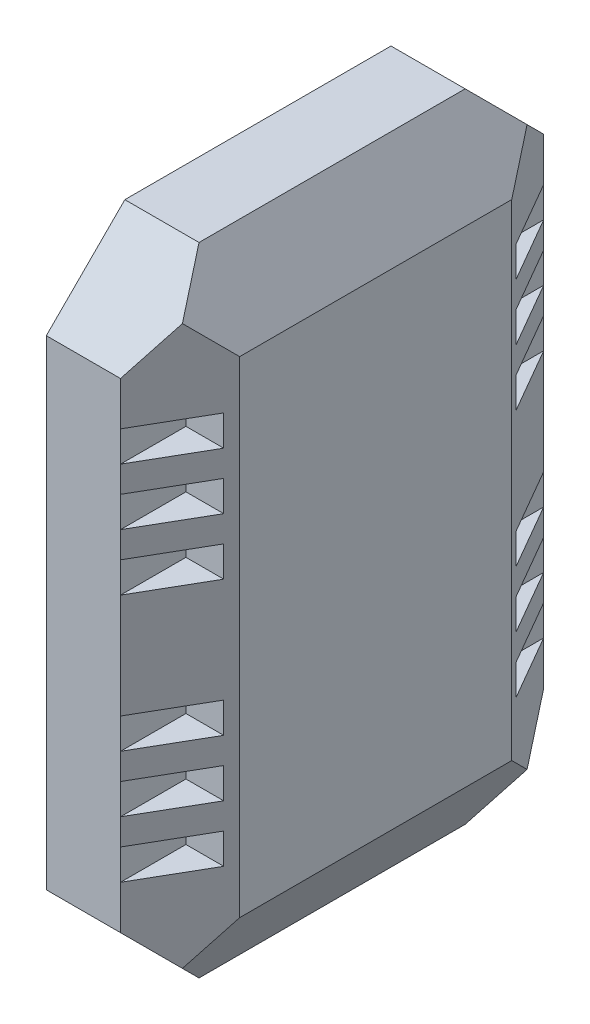
from build123d import *
from OCP.BRepFilletAPI import BRepFilletAPI_MakeChamfer

# Parameters (mm, degrees)
SKETCH1_W               = 37.084
SKETCH1_H               = 24.638
BOSS_EXTRUDE1_DEPTH     = 6.858
CHAMFER2_SIZE           = 4.572
CHAMFER3_SIZE           = 2.54
CHAMFER3_SIZE2          = 4.399409051
CHAMFER4_SIZE           = 2.54
CHAMFER4_SIZE2          = 4.399409051
CUT_EXTRUDE1_DEPTH      = 46.04759998
CUT_EXTRUDE1_DEPTH_BACK = 2.54
SKETCH3_R               = 1
SKETCH4_W               = 1.778
SKETCH4_H               = 3.81
CUT_EXTRUDE2_DEPTH      = 2.54
SKETCH5_R               = 1.5875
CUT_EXTRUDE3_DEPTH      = 3.81


with BuildPart() as part:
    # Sketch1 → Boss-Extrude1 (new body)
    with BuildSketch(Plane.YZ):
        with Locations((18.542, -12.319)):
            Rectangle(SKETCH1_W, SKETCH1_H)
    extrude(amount=BOSS_EXTRUDE1_DEPTH)

    # Chamfer2
    chamfer2_edges = [part.edges().sort_by_distance(p)[0] for p in [
        (3.429, 0, 0),
        (3.429, 0, -24.638),
        (3.429, 37.084, 0),
        (3.429, 37.084, -24.638),
    ]]
    chamfer(chamfer2_edges, length=CHAMFER2_SIZE)

    # Chamfer3: one chamfer whose edges measure the first distance from different faces: ONE call of the kernel's chamfer builder (chamfer() names one face for all edges)
    chamfer3_edges_1 = [part.edges().sort_by_distance(p)[0] for p in [
        (6.858, 18.542, 0),
    ]]
    chamfer3_side_1 = [part.faces().sort_by_distance(p)[0] for p in [
        (3.429, 18.542, 0),
    ]]
    chamfer3_edges_2 = [part.edges().sort_by_distance(p)[0] for p in [
        (6.858, 18.542, -24.638),
    ]]
    chamfer3_side_2 = [part.faces().sort_by_distance(p)[0] for p in [
        (3.429, 18.542, -24.638),
    ]]
    chamfer3 = BRepFilletAPI_MakeChamfer(part.part.solid().wrapped)
    for e in chamfer3_edges_1:
        chamfer3.Add(CHAMFER3_SIZE, CHAMFER3_SIZE2, e.wrapped, chamfer3_side_1[0].wrapped)  # the first distance lies on this face
    for e in chamfer3_edges_2:
        chamfer3.Add(CHAMFER3_SIZE, CHAMFER3_SIZE2, e.wrapped, chamfer3_side_2[0].wrapped)  # the first distance lies on this face
    add(Compound.cast(chamfer3.Shape()), mode=Mode.REPLACE)

    # Chamfer4: one chamfer whose edges measure the first distance from different faces: ONE call of the kernel's chamfer builder (chamfer() names one face for all edges)
    chamfer4_edges_1 = [part.edges().sort_by_distance(p)[0] for p in [
        (6.858, 0, -12.319),
    ]]
    chamfer4_side_1 = [part.faces().sort_by_distance(p)[0] for p in [
        (3.429, 0, -12.319),
    ]]
    chamfer4_edges_2 = [part.edges().sort_by_distance(p)[0] for p in [
        (6.858, 37.084, -12.319),
    ]]
    chamfer4_side_2 = [part.faces().sort_by_distance(p)[0] for p in [
        (3.429, 37.084, -12.319),
    ]]
    chamfer4 = BRepFilletAPI_MakeChamfer(part.part.solid().wrapped)
    for e in chamfer4_edges_1:
        chamfer4.Add(CHAMFER4_SIZE, CHAMFER4_SIZE2, e.wrapped, chamfer4_side_1[0].wrapped)  # the first distance lies on this face
    for e in chamfer4_edges_2:
        chamfer4.Add(CHAMFER4_SIZE, CHAMFER4_SIZE2, e.wrapped, chamfer4_side_2[0].wrapped)  # the first distance lies on this face
    add(Compound.cast(chamfer4.Shape()), mode=Mode.REPLACE)

    # Sketch3 → Cut-Extrude1 (cut, two sides: drawn at the far end of the back side and taken through both)
    with BuildSketch(Plane(origin=(0, 0, 0), x_dir=(0, -1, 0), z_dir=(-1, 0, 0)).offset(-CUT_EXTRUDE1_DEPTH_BACK)):
        with Locations((-8.542, -2.319)):
            Circle(SKETCH3_R)
        with Locations((-8.542, -22.319)):
            Circle(SKETCH3_R)
        with Locations((-28.542, -22.319)):
            Circle(SKETCH3_R)
        with Locations((-28.542, -2.319)):
            Circle(SKETCH3_R)
    extrude(amount=CUT_EXTRUDE1_DEPTH + CUT_EXTRUDE1_DEPTH_BACK, mode=Mode.SUBTRACT)

    # Sketch4 → Cut-Extrude2 (cut)
    with BuildSketch(Plane.YZ.offset(6.858)):
        with Locations((8.001, -1.905)):
            Rectangle(SKETCH4_W, SKETCH4_H)
        with Locations((11.303, -1.905)):
            Rectangle(SKETCH4_W, SKETCH4_H)
        with Locations((14.605, -1.905)):
            Rectangle(SKETCH4_W, SKETCH4_H)
        with Locations((22.479, -1.905)):
            Rectangle(SKETCH4_W, SKETCH4_H)
        with Locations((25.781, -1.905)):
            Rectangle(SKETCH4_W, SKETCH4_H)
        with Locations((29.083, -1.905)):
            Rectangle(SKETCH4_W, SKETCH4_H)
        with Locations((29.083, -22.733)):
            Rectangle(SKETCH4_W, SKETCH4_H)
        with Locations((25.781, -22.733)):
            Rectangle(SKETCH4_W, SKETCH4_H)
        with Locations((22.479, -22.733)):
            Rectangle(SKETCH4_W, SKETCH4_H)
        with Locations((14.605, -22.733)):
            Rectangle(SKETCH4_W, SKETCH4_H)
        with Locations((11.303, -22.733)):
            Rectangle(SKETCH4_W, SKETCH4_H)
        with Locations((8.001, -22.733)):
            Rectangle(SKETCH4_W, SKETCH4_H)
    extrude(amount=-CUT_EXTRUDE2_DEPTH, mode=Mode.SUBTRACT)

    # Sketch5 → Cut-Extrude3 (cut)
    with BuildSketch(Plane.XZ):
        with Locations((2.159, -12.319)):
            Circle(SKETCH5_R)
    extrude(amount=-CUT_EXTRUDE3_DEPTH, mode=Mode.SUBTRACT)


solid = part.part
